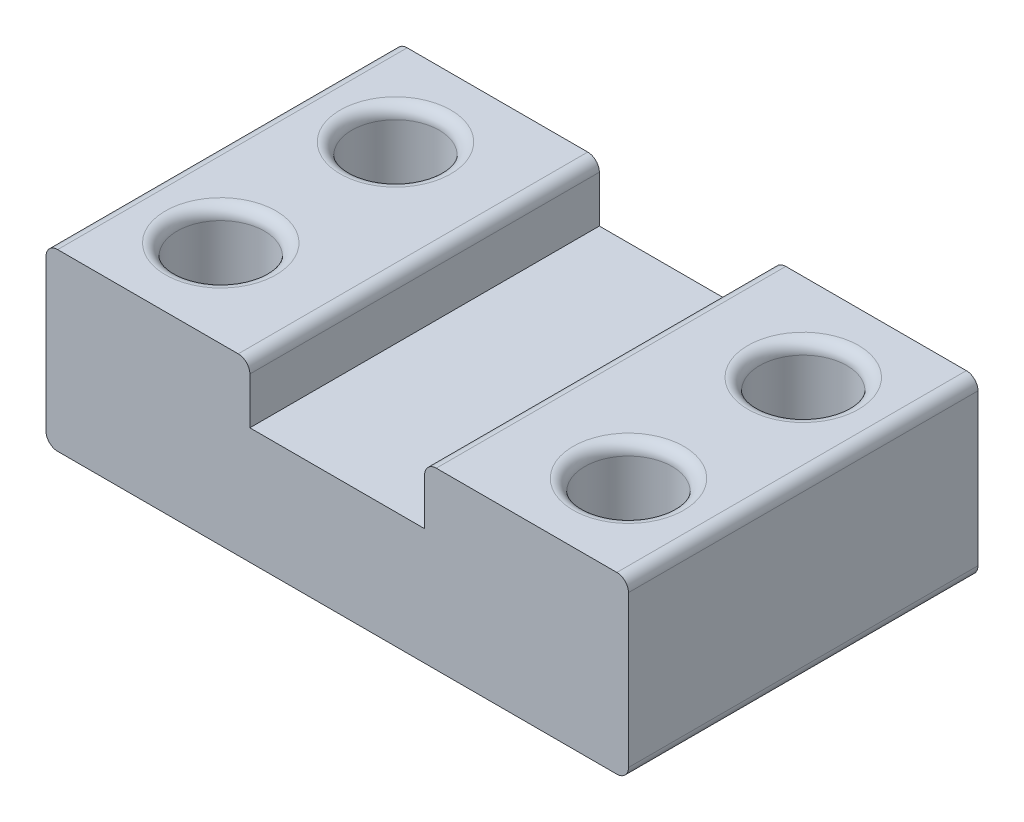
from build123d import *

# Parameters (mm, degrees)
SKETCH1_W           = 127
SKETCH1_H           = 76.2
SKETCH1_R           = 9.525
BOSS_EXTRUDE1_DEPTH = 38.1
SKETCH2_W           = 38.1
SKETCH2_H           = 76.2
CUT_EXTRUDE1_DEPTH  = 12.7
FILLET1_R           = 2.54
SHELL1_OUTLINE_W    = 121.92
SHELL1_OUTLINE_H    = 71.12
SHELL1_OUTLINE_R    = 12.065
SHELL1_DEPTH        = 22.86
SHELL1_START        = 22.86
SHELL1_2_OUTLINE_W  = 39.37
SHELL1_2_OUTLINE_H  = 71.12
SHELL1_2_OUTLINE_R  = 12.065
SHELL1_2_DEPTH      = 12.7
SHELL1_3_OUTLINE_R  = 12.065
SHELL1_3_DEPTH      = 2.54


# Read off the part's stored shape, not the designer's step: Shell1
with BuildPart() as part:
    # Sketch1 → Boss-Extrude1 (new body)
    with BuildSketch(Plane(origin=(0, 0, 0), x_dir=(1, 0, 0), z_dir=(0, 1, 0))):
        Rectangle(SKETCH1_W, SKETCH1_H)
        with Locations(Location((-44.45, 19.05, 0), (0, 0, 90))):
            Circle(SKETCH1_R, mode=Mode.SUBTRACT)
        with Locations(Location((44.45, 19.05, 0), (0, 0, 90))):
            Circle(SKETCH1_R, mode=Mode.SUBTRACT)
        with Locations(Location((-44.45, -19.05, 0), (0, 0, 90))):
            Circle(SKETCH1_R, mode=Mode.SUBTRACT)
        with Locations(Location((44.45, -19.05, 0), (0, 0, 90))):
            Circle(SKETCH1_R, mode=Mode.SUBTRACT)
    extrude(amount=BOSS_EXTRUDE1_DEPTH)

    # Sketch2 → Cut-Extrude1 (cut)
    with BuildSketch(Plane(origin=(0, 38.1, 0), x_dir=(1, 0, 0), z_dir=(0, 1, 0))):
        Rectangle(SKETCH2_W, SKETCH2_H)
    extrude(amount=-CUT_EXTRUDE1_DEPTH, mode=Mode.SUBTRACT)

    # Fillet1
    fillet1_edges = [part.edges().sort_by_distance(p)[0] for p in [
        (-44.45, 0, -9.525),
        (-44.45, 38.1, -9.525),
        (-63.5, 38.1, 0),
        (44.45, 38.1, -9.525),
        (-44.45, 38.1, 28.575),
        (44.45, 38.1, 28.575),
        (19.05, 38.1, 0),
        (-19.05, 38.1, 0),
        (63.5, 38.1, 0),
        (-63.5, 0, 0),
        (63.5, 0, 0),
    ]]
    fillet(fillet1_edges, radius=FILLET1_R)

    # Shell1 outline → Shell1 (cut)
    with BuildSketch(Plane(origin=(0, 0, 0), x_dir=(1, 0, 0), z_dir=(0, 1, 0))):
        Rectangle(SHELL1_OUTLINE_W, SHELL1_OUTLINE_H)
        with Locations((44.45, -19.05)):
            Circle(SHELL1_OUTLINE_R, mode=Mode.SUBTRACT)
        with Locations((44.45, 19.05)):
            Circle(SHELL1_OUTLINE_R, mode=Mode.SUBTRACT)
        with Locations((-44.45, 19.05)):
            Circle(SHELL1_OUTLINE_R, mode=Mode.SUBTRACT)
        with Locations((-44.45, -19.05)):
            Circle(SHELL1_OUTLINE_R, mode=Mode.SUBTRACT)
    extrude(amount=SHELL1_DEPTH, mode=Mode.SUBTRACT)

    # Shell1 2 outline → Shell1 2 (cut)
    # profile 1 of 2: a face of its own
    with BuildSketch(Plane(origin=(0, 0, 0), x_dir=(1, 0, 0), z_dir=(0, 1, 0)).offset(SHELL1_START)):
        with Locations((41.275, 0)):
            Rectangle(SHELL1_2_OUTLINE_W, SHELL1_2_OUTLINE_H)
        with Locations((44.45, -19.05)):
            Circle(SHELL1_2_OUTLINE_R, mode=Mode.SUBTRACT)
        with Locations((44.45, 19.05)):
            Circle(SHELL1_2_OUTLINE_R, mode=Mode.SUBTRACT)
    # profile 2 of 2: a face of its own
    with BuildSketch(Plane(origin=(0, 0, 0), x_dir=(1, 0, 0), z_dir=(0, 1, 0)).offset(SHELL1_START)):
        with Locations((-41.275, 0)):
            Rectangle(SHELL1_2_OUTLINE_W, SHELL1_2_OUTLINE_H)
        with Locations((-44.45, -19.05)):
            Circle(SHELL1_2_OUTLINE_R, mode=Mode.SUBTRACT)
        with Locations((-44.45, 19.05)):
            Circle(SHELL1_2_OUTLINE_R, mode=Mode.SUBTRACT)
    extrude(amount=SHELL1_2_DEPTH, mode=Mode.SUBTRACT)

    # Shell1 3 outline → Shell1 3 (cut)
    with BuildSketch(Plane(origin=(0, 0, 0), x_dir=(1, 0, 0), z_dir=(0, 1, 0))):
        with Locations((-44.45, 19.05)):
            Circle(SHELL1_3_OUTLINE_R)
    extrude(amount=SHELL1_3_DEPTH, mode=Mode.SUBTRACT)


solid = part.part
